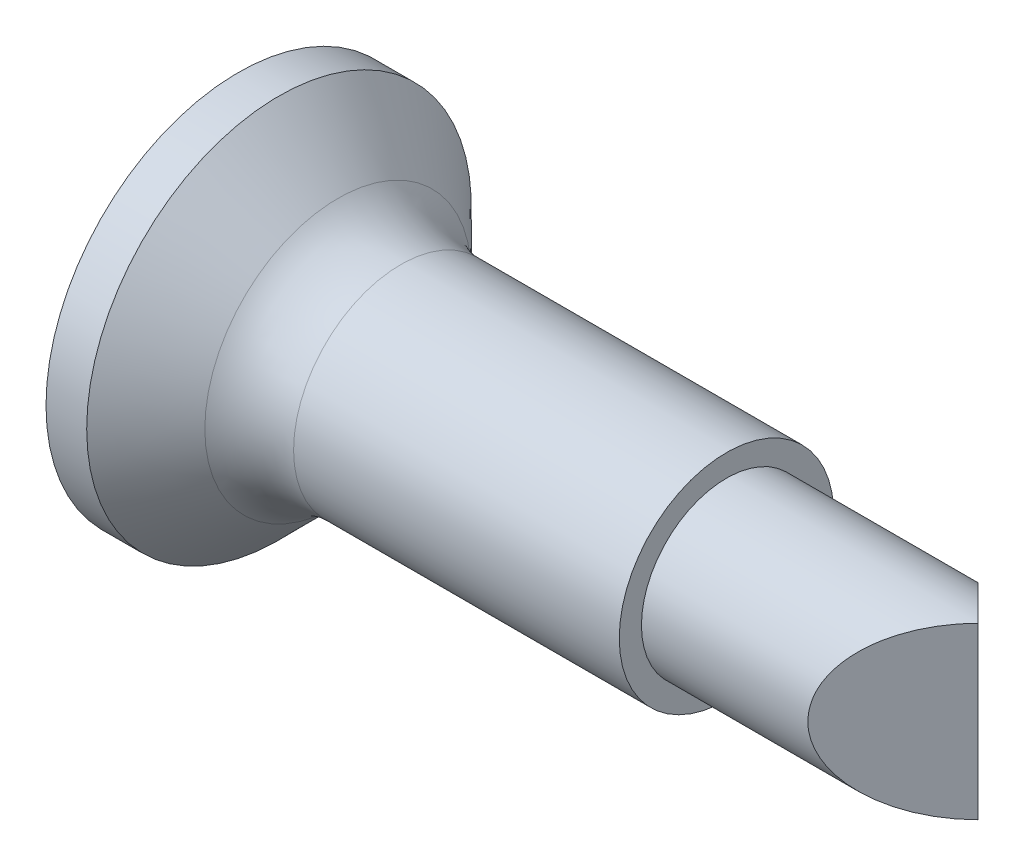
from build123d import *

# Parameters (mm, degrees)
FILLET1_R               = 1.2
CUT_EXTRUDE1_DEPTH      = 11.65457653
CUT_EXTRUDE1_DEPTH_BACK = 11.65457653
CROSSRECESS_DEPTH       = 0.566666667
FILLET2_R               = 0.32
DRAFT1_ANGLE            = 25


with BuildPart() as part:
    # Sketch1 → Base (revolve)
    with BuildSketch(Plane.XY):
        Polygon((0, 0), (0, 2.6), (0.55, 2.6), (1.7, 1.45), (6.6, 1.45), (6.6, 1.15), (10, 1.15), (10, 0), align=None)
    revolve(axis=Axis((-9.542985634, 0, 0), (1, 0, 0)))

    # Fillet1
    fillet1_edges = [part.edges().sort_by_distance(p)[0] for p in [
        (1.7, -1.45, 0),
    ]]
    fillet(fillet1_edges, radius=FILLET1_R)

    # Sketch2 → Cut-Extrude1 (cut, two sides: drawn at the far end of the back side and taken through both)
    with BuildSketch(Plane(origin=(0, 0, 0), x_dir=(1, 0, 0), z_dir=(0, 1, 0)).offset(-CUT_EXTRUDE1_DEPTH_BACK)):
        Polygon((10.37032733, -10), (10.37032733, 10), (0, 10), (10, 0), (0, -10), align=None)
    extrude(amount=CUT_EXTRUDE1_DEPTH + CUT_EXTRUDE1_DEPTH_BACK, mode=Mode.SUBTRACT)

    # Sketch3 → CrossRecess (cut)
    with BuildSketch(Plane(origin=(0, 0, 0), x_dir=(0, 0, -1), z_dir=(1, 0, 0))):
        Polygon((-0.32, 0.32), (-1.6, 0.32), (-1.6, -0.32), (-0.32, -0.32), (-0.32, -1.6), (0.32, -1.6), (0.32, -0.32), (1.6, -0.32), (1.6, 0.32), (0.32, 0.32), (0.32, 1.6), (-0.32, 1.6), align=None)
    extrude(amount=CROSSRECESS_DEPTH, mode=Mode.SUBTRACT)

    # Fillet2
    fillet2_edges = [part.edges().sort_by_distance(p)[0] for p in [
        (0.283333333, 0.32, 0.32),
        (0.283333333, -0.32, 0.32),
        (0.283333333, 0.32, -0.32),
        (0.283333333, -0.32, -0.32),
    ]]
    fillet(fillet2_edges, radius=FILLET2_R)

    # Draft1
    draft1_faces = [part.faces().sort_by_distance(p)[0] for p in [
        (0.283333333, 0, 1.6),
        (0.283333333, 1.6, 0),
        (0.283333333, -1.6, 0),
        (0.283333333, 0, -1.6),
    ]]
    draft(draft1_faces, Plane(origin=(0, 0, 0), x_dir=(0, 0, -1), z_dir=(-1, 0, 0)), DRAFT1_ANGLE)


solid = part.part
